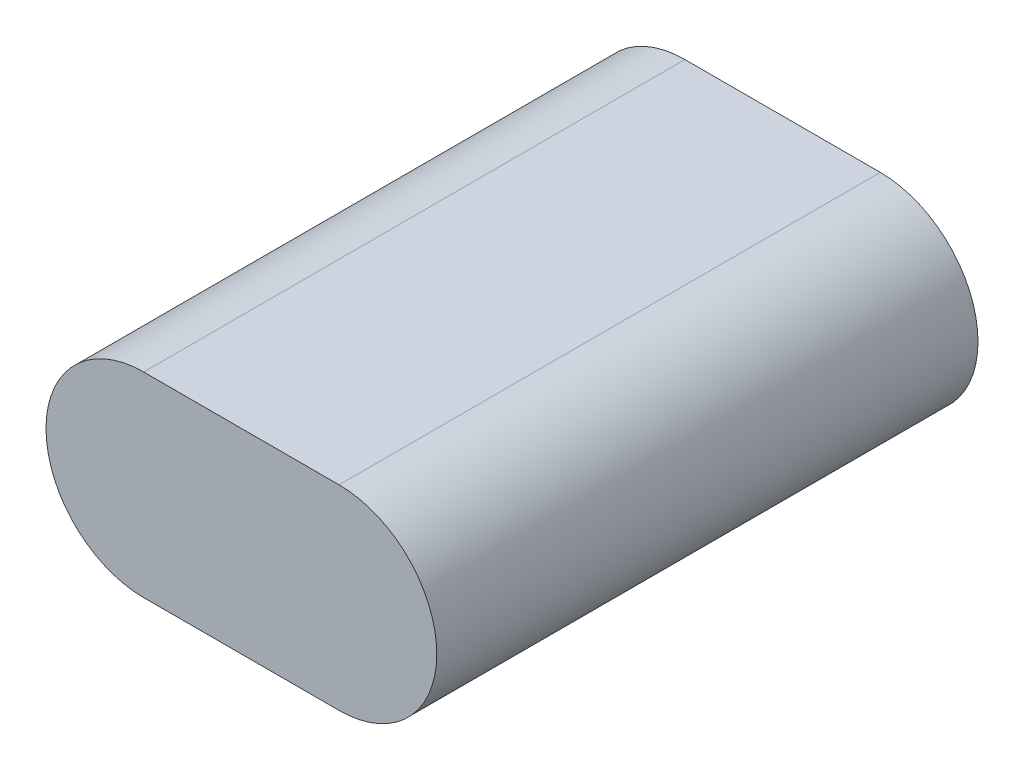
from build123d import *

# Parameters (mm, degrees)
EXTRUDE_1_DEPTH = 138.5


with BuildPart() as part:
    # 草图1 → 凸台-拉伸1 (new, symmetric)
    with BuildSketch(Plane.XY):
        with BuildLine():
            Line((-50, 50), (50, 50))
            ThreePointArc((50, 50), (100, 0), (50, -50))
            Line((50, -50), (-50, -50))
            ThreePointArc((-50, -50), (-100, 0), (-50, 50))
        make_face()
    extrude(amount=EXTRUDE_1_DEPTH, both=True)


solid = part.part
